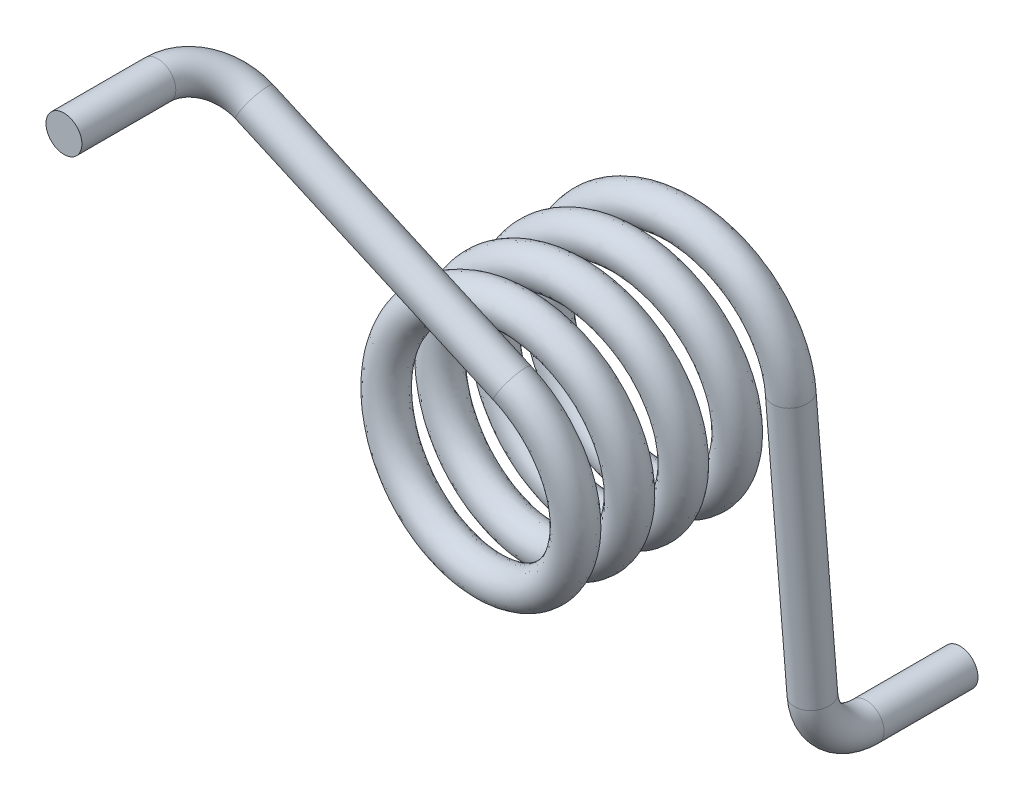
from build123d import *

# Parameters (mm, degrees)
SWEEP_2_PITCH     = 3
SWEEP_2_HEIGHT    = 12.5
SWEEP_2_RADIUS    = 6
SWEEP_2_PROFILE_R = 1
SWEEP_4_PROFILE_R = 1
SWEEP_5_PROFILE_R = 1


with BuildPart() as part:
    # 扫描2: sweep along a helix
    with BuildLine() as sweep_2_path:
        Helix(SWEEP_2_PITCH, SWEEP_2_HEIGHT, SWEEP_2_RADIUS, center=(0, 0, 0), direction=(0, 0, 1))
    # 扫描2 profile (on start of the path) → 扫描2 (sweep)
    with BuildSketch(Plane(origin=(6, 0, 0), x_dir=(0, -0.07932669684367408, 0.9968486721503279), z_dir=(1.835818459132732e-13, 0.9968486721503279, 0.07932669684367408))):
        Circle(SWEEP_2_PROFILE_R)
    sweep(path=sweep_2_path.line, is_frenet=True)


with BuildPart() as sweep_4_tool:
    # 扫描4: sweep along a path in 草图54
    with BuildLine(Plane(origin=(3.000051174, 5.196122877, 0), x_dir=(-0.8632913650367979, 0.4984328382247466, 0.07932669684365842), z_dir=(0.5000085290273435, 0.8660204794922072, 0))) as sweep_4_path:
        Line((19.626255545, 20.435393092), (19.211436531, 15.222623624))
        ThreePointArc((19.211436531, 15.222623624), (18.256333922, 13.25675024), (16.220890515, 12.460603714))
        Line((16.220890515, 12.460603714), (0.99164197, 12.460603714))
    # 扫描4 profile (on start of the path) → 扫描4 (sweep)
    with BuildSketch(Plane(origin=(-12.539244014, 14.167943189, 21.927880492), x_dir=(-1, 0, 0), z_dir=(0, 0, -1))):
        Circle(SWEEP_4_PROFILE_R)
    sweep(path=sweep_4_path.line)


with BuildPart() as part_1:
    add(part.part)


with BuildPart() as part_2:
    # 扫描4: joined with sweep_4_tool
    add(part_1.part.fuse(sweep_4_tool.part, tol=0.00001))

    # 扫描5: sweep along a path in 草图97
    with BuildLine(Plane(origin=(6, 0, 0), x_dir=(0, -0.9968486721503291, -0.07932669684365838), z_dir=(-1, 0, 0))) as sweep_5_path:
        Line((0, 0), (15.229248544, 0))
        ThreePointArc((15.229248544, 0), (17.264691952, -0.796146526), (18.219794561, -2.762019909))
        Line((18.219794561, -2.762019909), (18.634613575, -7.974789377))
    # 扫描5 profile (on start of the path) → 扫描5 (sweep)
    with BuildSketch(Plane(origin=(6, 0, 0), x_dir=(0, 0.07932669684365833, -0.9968486721503291), z_dir=(0, -0.9968486721503291, -0.07932669684365833))):
        Circle(SWEEP_5_PROFILE_R)
    sweep(path=sweep_5_path.line)


solid = part_2.part
